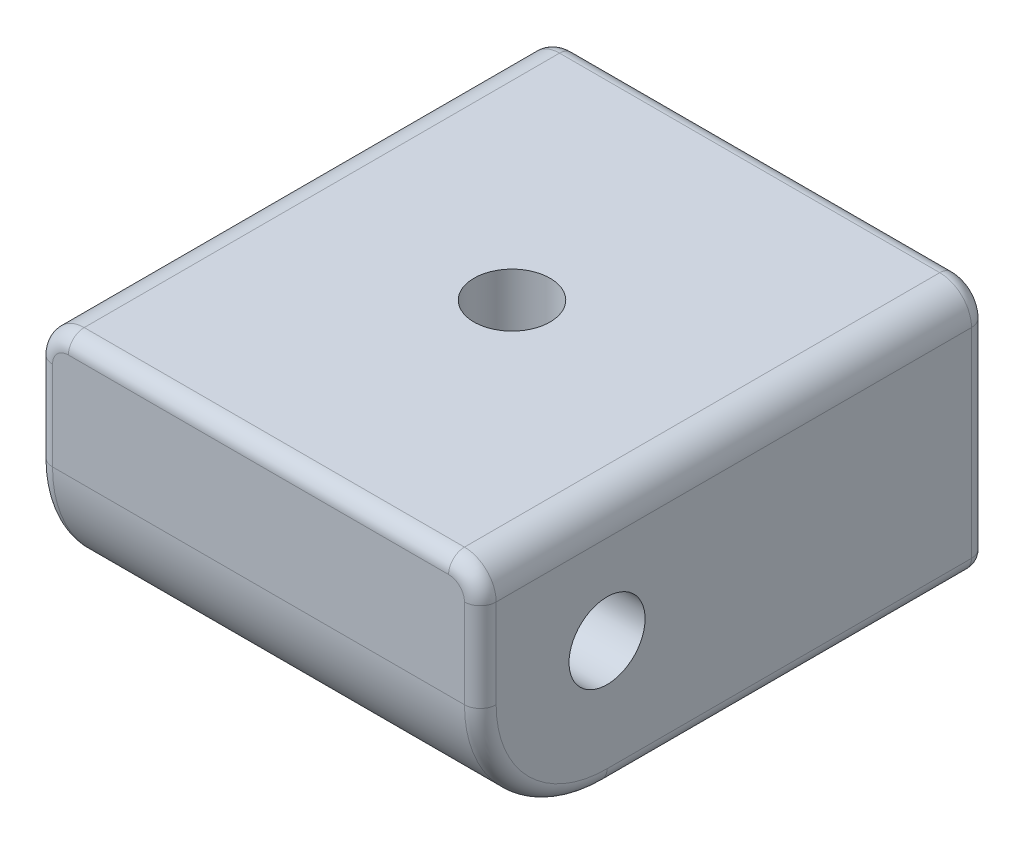
from build123d import *

# Parameters (mm, degrees)
SKETCH1_R           = 1.905
BOSS_EXTRUDE1_DEPTH = 12.7
BOSS_EXTRUDE2_DEPTH = 12.7
CUT_EXTRUDE1_REACH  = 37.955
SKETCH3_R           = 1.905
SKETCH4_R           = 1.905
CUT_EXTRUDE2_DEPTH  = 10.8077
FILLET1_R           = 0.79375
FILLET2_R           = 6.35


with BuildPart() as part:
    # Sketch1 → Boss-Extrude1 (new body)
    with BuildSketch(Plane.XY):
        with BuildLine():
            Line((-11.1125, 0), (11.1125, 0))
            Line((11.1125, 0), (11.1125, 10.8077))
            ThreePointArc((11.1125, 10.8077), (10.647532015, 11.930232015), (9.525, 12.3952))
            Line((9.525, 12.3952), (-9.525, 12.3952))
            ThreePointArc((-9.525, 12.3952), (-10.647532015, 11.930232015), (-11.1125, 10.8077))
            Line((-11.1125, 10.8077), (-11.1125, 0))
        make_face()
        with Locations((-6.35, 6.35)):
            Circle(SKETCH1_R, mode=Mode.SUBTRACT)
        with Locations((6.35, 6.35)):
            Circle(SKETCH1_R, mode=Mode.SUBTRACT)
    extrude(amount=BOSS_EXTRUDE1_DEPTH)

    # Sketch2 → Boss-Extrude2 (add)
    with BuildSketch(Plane.XY.offset(12.7)):
        with BuildLine():
            Line((11.1125, 0), (11.1125, 10.8077))
            ThreePointArc((11.1125, 10.8077), (10.647532015, 11.930232015), (9.525, 12.3952))
            Line((9.525, 12.3952), (-9.525, 12.3952))
            ThreePointArc((-9.525, 12.3952), (-10.647532015, 11.930232015), (-11.1125, 10.8077))
            Line((-11.1125, 10.8077), (-11.1125, 0))
            Line((-11.1125, 0), (11.1125, 0))
        make_face()
    extrude(amount=BOSS_EXTRUDE2_DEPTH)

    # Sketch3 → Cut-Extrude1 (cut, up to next)
    with BuildSketch(Plane(origin=(11.1125, 0, 0), x_dir=(0, 0, -1), z_dir=(1, 0, 0)), mode=Mode.PRIVATE) as cut_extrude1_sk1:
        with Locations(Location((-19.05, 6.35, 0), (0, 0, 90))):
            Circle(SKETCH3_R)
    cut_extrude1_tool1 = extrude(cut_extrude1_sk1.sketch, amount=-CUT_EXTRUDE1_REACH, mode=Mode.PRIVATE) & part.part
    add(cut_extrude1_tool1.solids().sort_by_distance((11.1125, 6.35, 19.05))[0], mode=Mode.SUBTRACT)

    # Sketch4 → Cut-Extrude2 (cut)
    with BuildSketch(Plane(origin=(0, 12.3952, 0), x_dir=(1, 0, 0), z_dir=(0, 1, 0))):
        with Locations(Location((0, -12.7, 0), (0, 0, 180))):
            Circle(SKETCH4_R)
    extrude(amount=-CUT_EXTRUDE2_DEPTH, mode=Mode.SUBTRACT)

    # Fillet1
    fillet1_edges = [part.edges().sort_by_distance(p)[0] for p in [
        (11.1125, 0, 12.7),
        (-11.1125, 0, 12.7),
        (11.1125, 5.40385, 25.4),
        (10.647532015, 11.930232015, 25.4),
        (0, 12.3952, 25.4),
        (-10.647532015, 11.930232015, 25.4),
        (-11.1125, 5.40385, 25.4),
        (0, 0, 0),
        (-11.1125, 5.40385, 0),
        (-10.647532015, 11.930232015, 0),
        (0, 12.3952, 0),
        (10.647532015, 11.930232015, 0),
        (11.1125, 5.40385, 0),
    ]]
    fillet(fillet1_edges, radius=FILLET1_R)

    # Fillet2
    # the kernel refuses this fillet: 6.35 mm, written as the material it takes off along each edge
    with BuildSketch(Plane(origin=(-11.1125, 6.35, 19.05), x_dir=(0, -1, 0), z_dir=(0, 0, -1))) as fillet2_piece_1:
        with BuildLine():
            CenterArc((5.55625, -0.79375), 0.79375, 0, 90)
            Line((6.35, -0.79375), (6.35, 0))
            Line((6.35, 0), (5.55625, 0))
        make_face()
    revolve(axis=Axis((-11.1125, 6.35, 19.05), (-1, 0, 0)), revolution_arc=90, mode=Mode.SUBTRACT)
    with BuildSketch(Plane(origin=(11.1125, 6.35, 19.05), x_dir=(0, 0, 1), z_dir=(0, 1, 0))) as fillet2_piece_2:
        with BuildLine():
            CenterArc((5.55625, -0.79375), 0.79375, 0, 90)
            Line((6.35, -0.79375), (6.35, 0))
            Line((6.35, 0), (5.55625, 0))
        make_face()
    revolve(axis=Axis((11.1125, 6.35, 19.05), (1, 0, 0)), revolution_arc=90, mode=Mode.SUBTRACT)
    with BuildSketch(Plane(origin=(-11.1125, 0, 25.4), x_dir=(0, 0, -1), z_dir=(1, 0, 0))) as fillet2_piece_3:
        with BuildLine():
            CenterArc((FILLET2_R, FILLET2_R), FILLET2_R, 180, 90)
            Line((0, FILLET2_R), (0, 0))
            Line((0, 0), (FILLET2_R, 0))
        make_face()
    extrude(amount=22.225, mode=Mode.SUBTRACT)


solid = part.part
